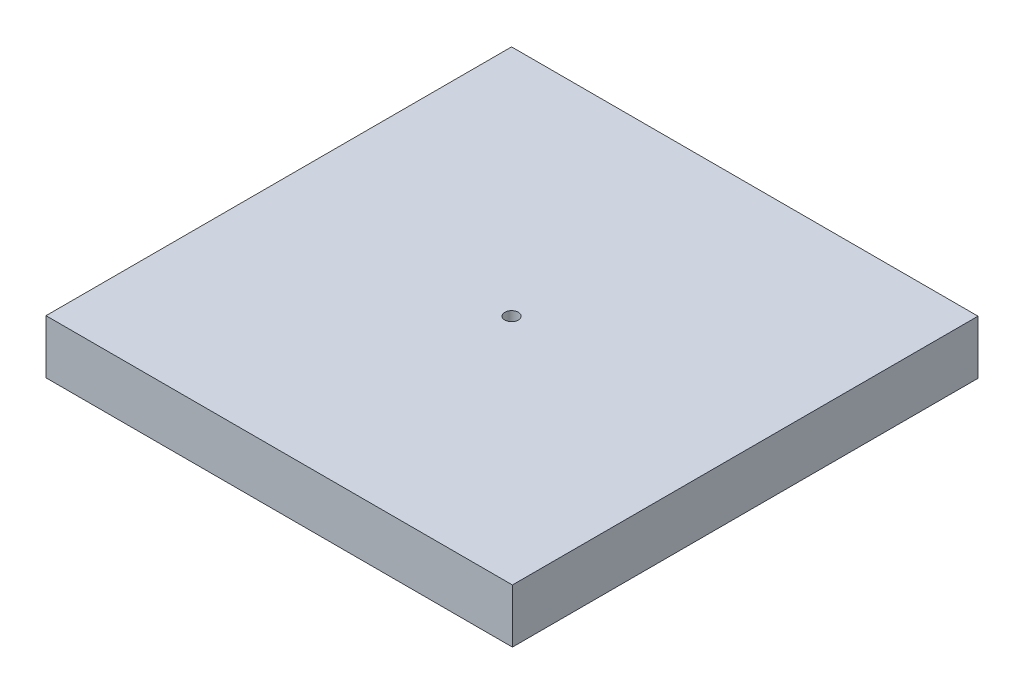
from build123d import *

# Parameters (mm, degrees)
SKETCH4_W           = 220
SKETCH4_H           = 220
BOSS_EXTRUDE2_DEPTH = 25.4
SKETCH5_R           = 3.2
CUT_EXTRUDE1_DEPTH  = 25.4
SKETCH13_W          = 220
SKETCH13_H          = 25.4
BOSS_EXTRUDE3_DEPTH = 25
SKETCH14_W          = 220
SKETCH14_H          = 25.4
CUT_EXTRUDE2_DEPTH  = 25.4


with BuildPart() as part:
    # Sketch4 → Boss-Extrude2 (new body)
    with BuildSketch(Plane(origin=(0, 0, 0), x_dir=(1, 0, 0), z_dir=(0, 1, 0))):
        with Locations((171.772904357, 21.481047821)):
            Rectangle(SKETCH4_W, SKETCH4_H)
    extrude(amount=BOSS_EXTRUDE2_DEPTH)

    # Sketch5 → Cut-Extrude1 (cut)
    with BuildSketch(Plane(origin=(0, 25.4, 0), x_dir=(1, 0, 0), z_dir=(0, 1, 0))):
        with Locations((171.772904357, 21.481047821)):
            Circle(SKETCH5_R)
    extrude(amount=-CUT_EXTRUDE1_DEPTH, mode=Mode.SUBTRACT)

    # Sketch13 → Boss-Extrude3 (add)
    with BuildSketch(Plane.XY.offset(88.518952179)):
        with Locations((171.772904357, 12.7)):
            Rectangle(SKETCH13_W, SKETCH13_H)
    extrude(amount=BOSS_EXTRUDE3_DEPTH)

    # Sketch14 → Cut-Extrude2 (cut)
    with BuildSketch(Plane.XY.offset(113.518952179)):
        with Locations((171.772904357, 12.7)):
            Rectangle(SKETCH14_W, SKETCH14_H)
    extrude(amount=-CUT_EXTRUDE2_DEPTH, mode=Mode.SUBTRACT)


solid = part.part
